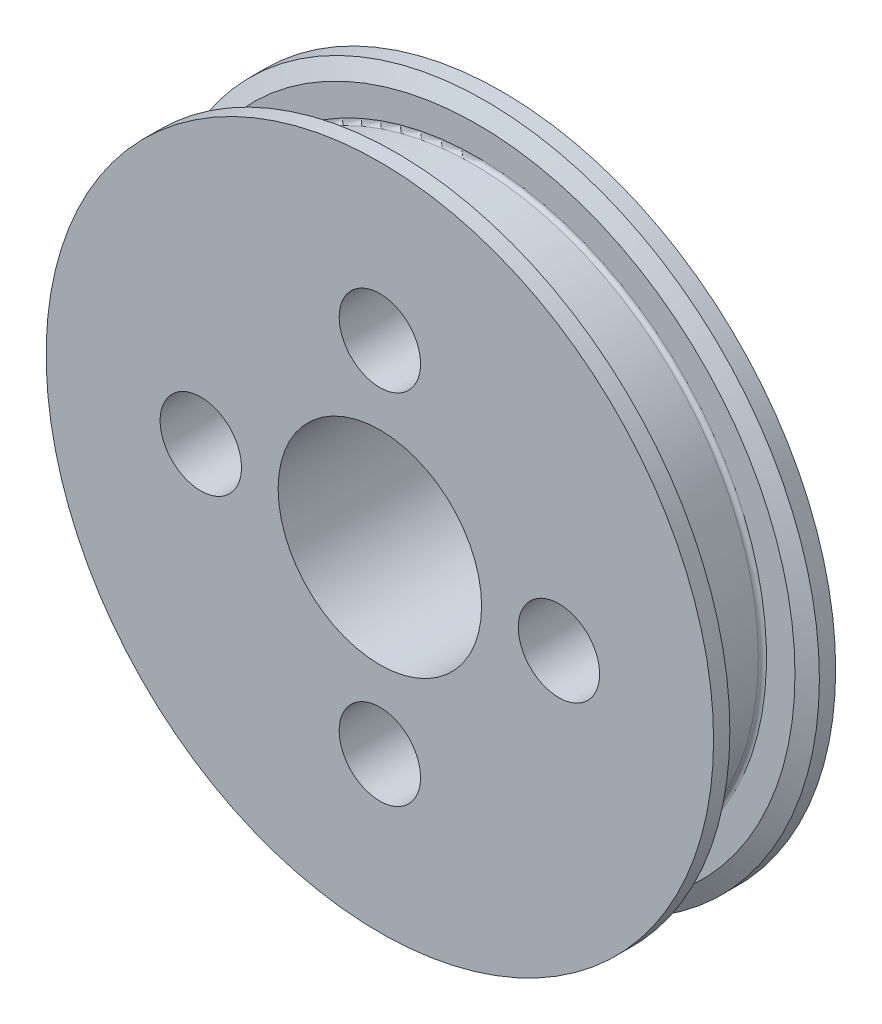
from build123d import *

# Parameters (mm, degrees)
SKETCH3_W               = 16.51
SKETCH3_H               = 16.51
SKETCH3_R               = 6.35
BOSS_EXTRUDE1_DEPTH     = 3.175
CUT_EXTRUDE1_DEPTH      = 31.424916894
CUT_EXTRUDE1_DEPTH_BACK = 31.424916894
SKETCH4_R               = 2.54
FILLET1_R               = 0.254


with BuildPart() as part:
    # Sketch2 → Revolve1 (revolve)
    with BuildSketch(Plane(origin=(0, 0, 0), x_dir=(0, 0, -1), z_dir=(1, 0, 0))):
        Polygon((0, 6.35), (0, 20.828), (1.016, 20.828), (1.524, 19.812), (1.524, 17.78), (6.096, 17.78), (6.096, 19.812), (6.604, 20.828), (7.62, 20.828), (7.62, 6.35), align=None)
    revolve(axis=Axis((0, 0, 0), (0, 0, -1)))

    # Sketch3 → Boss-Extrude1 (add)
    with BuildSketch(Plane(origin=(0, 0, -7.62), x_dir=(-1, 0, 0), z_dir=(0, 0, -1))):
        Rectangle(SKETCH3_W, SKETCH3_H)
        Circle(SKETCH3_R, mode=Mode.SUBTRACT)
    extrude(amount=BOSS_EXTRUDE1_DEPTH)

    # Sketch4 → Cut-Extrude1 (cut, two sides: drawn at the far end of the back side and taken through both)
    with BuildSketch(Plane(origin=(0, 0, -7.62), x_dir=(-1, 0, 0), z_dir=(0, 0, -1)).offset(-CUT_EXTRUDE1_DEPTH_BACK)):
        with Locations((0, 11.176)):
            Circle(SKETCH4_R)
        with Locations((11.176, 0)):
            Circle(SKETCH4_R)
        with Locations((0, -11.176)):
            Circle(SKETCH4_R)
        with Locations((-11.176, 0)):
            Circle(SKETCH4_R)
    extrude(amount=CUT_EXTRUDE1_DEPTH + CUT_EXTRUDE1_DEPTH_BACK, mode=Mode.SUBTRACT)

    # Fillet1
    fillet1_edges = [part.edges().sort_by_distance(p)[0] for p in [
        (0, -17.78, -6.096),
        (0, -17.78, -1.524),
    ]]
    fillet(fillet1_edges, radius=FILLET1_R)


solid = part.part
